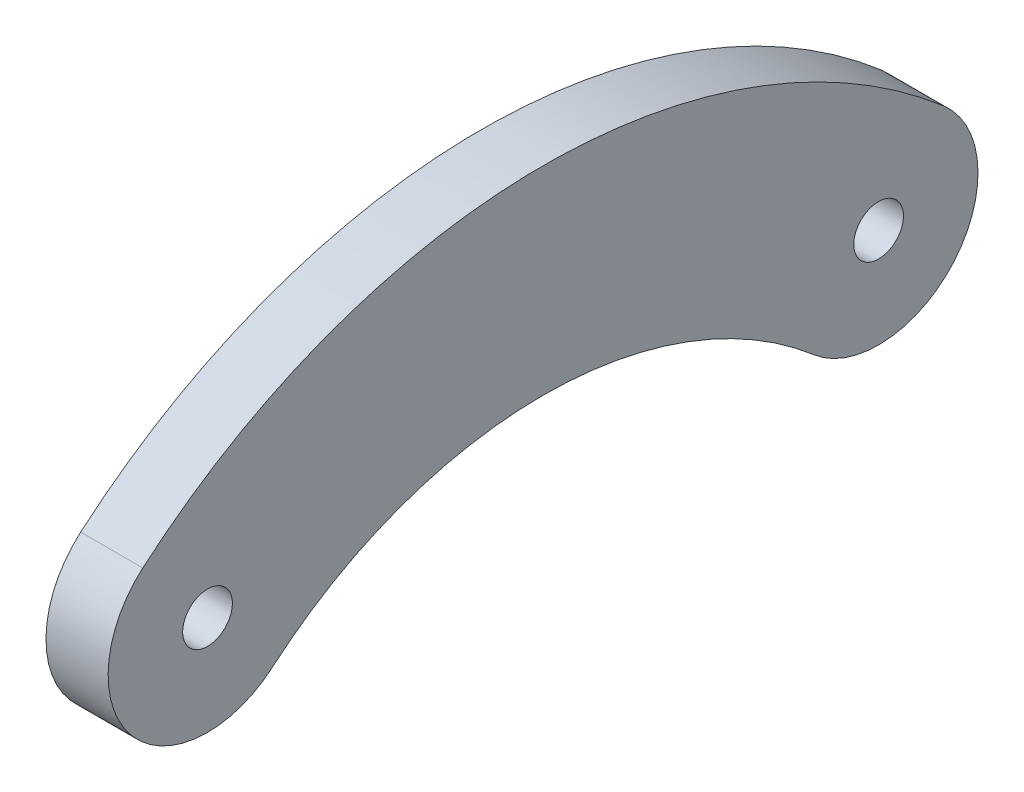
from build123d import *

# Parameters (mm, degrees)
SKETCH_1_R      = 1
EXTRUDE_1_DEPTH = 1.25


with BuildPart() as part:
    # 草图1 → 凸台-拉伸1 (new, symmetric)
    with BuildSketch(Plane(origin=(0, 0, 0), x_dir=(0, 0, -1), z_dir=(1, 0, 0))):
        with BuildLine():
            ThreePointArc((29.605548854, 3.034981906), (13.5, 9), (-2.605548854, 3.034981906))
            ThreePointArc((-2.605548854, 3.034981906), (-3.034981906, -2.605548854), (2.605548854, -3.034981906))
            ThreePointArc((2.605548854, -3.034981906), (13.5, 1), (24.394451146, -3.034981906))
            ThreePointArc((24.394451146, -3.034981906), (30.034981906, -2.605548854), (29.605548854, 3.034981906))
        make_face()
        Circle(SKETCH_1_R, mode=Mode.SUBTRACT)
        with Locations((27, 0)):
            Circle(SKETCH_1_R, mode=Mode.SUBTRACT)
    extrude(amount=EXTRUDE_1_DEPTH, both=True)


solid = part.part
